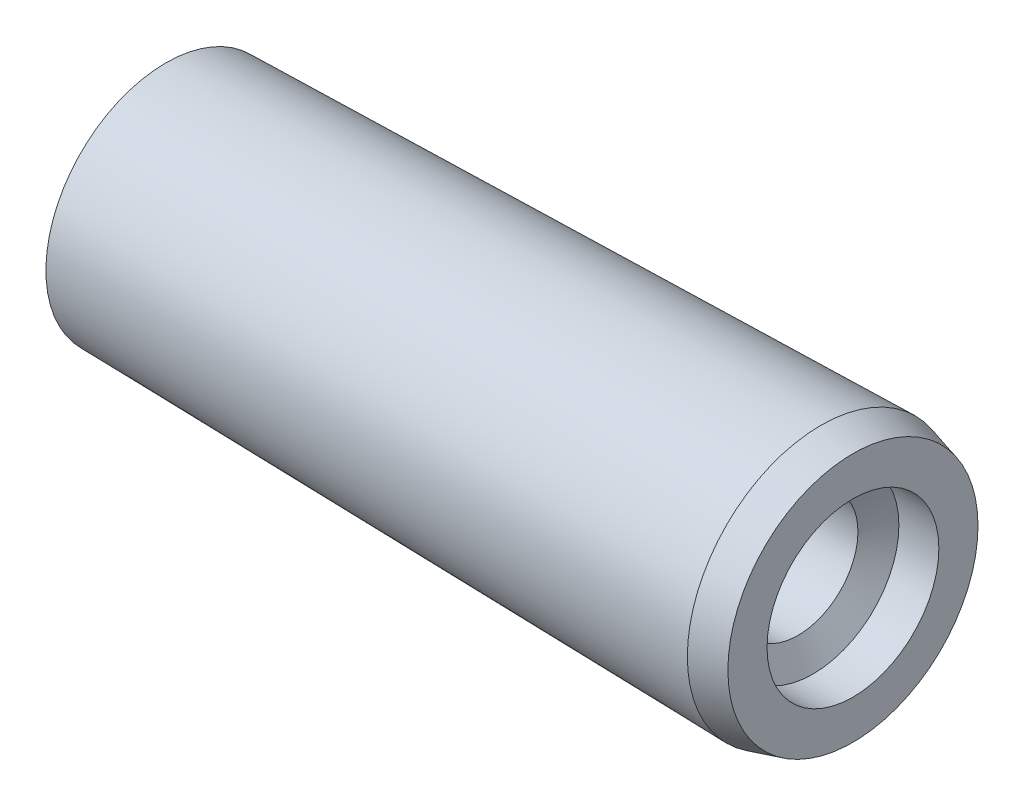
from build123d import *


with BuildPart() as part:
    # Sketch1 → Body (revolve)
    with BuildSketch(Plane.XY):
        with BuildLine():
            Line((18, 0), (18, 3.129640646))
            Line((18, 3.129640646), (17.2, 3.344))
            Line((17.2, 3.344), (0.803847577, 3))
            ThreePointArc((0.803847577, 3), (0.204445042, 1.552914271), (0, 0))
            Line((0, 0), (18, 0))
        make_face()
    revolve(axis=Axis((18, 0, 0), (-1, 0, 0)))

    # Sketch2 → Hole (revolve, cut)
    with BuildSketch(Plane.XY):
        Polygon((18, 0), (18, 2.15), (17, 2.15), (16.624722325, 1.5), (8, 1.5), (7.133974596, 0), align=None)
    revolve(axis=Axis((18, 0, 0), (-1, 0, 0)), mode=Mode.SUBTRACT)


solid = part.part
